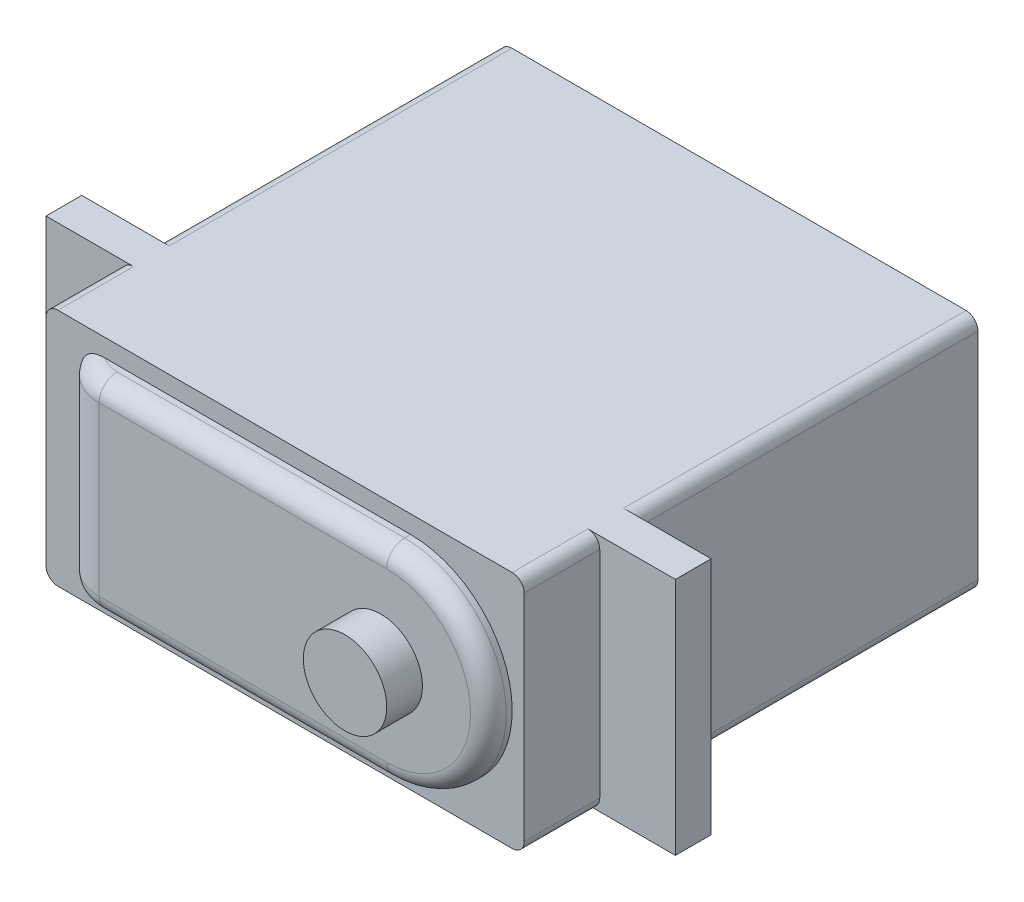
from build123d import *

# Parameters (mm, degrees)
SKETCH1_W           = 40.132
SKETCH1_H           = 20.066
BOSS_EXTRUDE1_DEPTH = 38.1
SKETCH2_W           = 6.35
SKETCH2_H           = 20.066
BOSS_EXTRUDE2_DEPTH = 3
BOSS_EXTRUDE4_DEPTH = 2
SKETCH5_R           = 3.5
BOSS_EXTRUDE3_DEPTH = 3
FILLET2_R           = 4
FILLET3_R           = 1.5
FILLET4_R           = 1


with BuildPart() as part:
    # Sketch1 → Boss-Extrude1 (new body)
    with BuildSketch(Plane.XY):
        Rectangle(SKETCH1_W, SKETCH1_H)
    extrude(amount=BOSS_EXTRUDE1_DEPTH)

    # Sketch2 → Boss-Extrude2 (add)
    with BuildSketch(Plane(origin=(0, 0, 31.75), x_dir=(-1, 0, 0), z_dir=(0, 0, -1))):
        with Locations((23.241, 0)):
            Rectangle(SKETCH2_W, SKETCH2_H)
        with Locations((-23.241, 0)):
            Rectangle(SKETCH2_W, SKETCH2_H)
    extrude(amount=BOSS_EXTRUDE2_DEPTH)

    # Sketch6 → Boss-Extrude4 (add)
    with BuildSketch(Plane.XY.offset(38.1)):
        with BuildLine():
            Line((-17.066, 8.533), (10.533, 8.533))
            ThreePointArc((10.533, 8.533), (19.066, 0), (10.533, -8.533))
            Line((10.533, -8.533), (-17.066, -8.533))
            Line((-17.066, -8.533), (-17.066, 8.533))
        make_face()
    extrude(amount=BOSS_EXTRUDE4_DEPTH)

    # Sketch5 → Boss-Extrude3 (add)
    with BuildSketch(Plane.XY.offset(40.1)):
        with Locations((10.033, 0)):
            Circle(SKETCH5_R)
    extrude(amount=BOSS_EXTRUDE3_DEPTH)

    # Fillet2
    # the kernel refuses this fillet: 4 mm, written as the material it takes off along each edge
    with BuildSketch(Plane(origin=(-17.066, -17.193254038, 40.1), x_dir=(0, 0, -1), z_dir=(0, 1, 0))) as fillet2_piece_1:
        with BuildLine():
            CenterArc((4, -3.464101615), FILLET2_R, 120, 60)
            Line((0, -3.464101615), (-0.08, -3.464101615))
            Line((-0.08, -3.464101615), (-0.08, 0))
            Line((-0.08, 0), (0, 0.08))
            ThreePointArc((0, 0.08), (1, 0.08), (1.96, 0.069282032))
            Line((1.96, 0.069282032), (2, 0))
        make_face()
    extrude(amount=34.386508076, mode=Mode.SUBTRACT)

    # Fillet3
    fillet3_edges = [part.edges().sort_by_distance(p)[0] for p in [
        (19.066, 0, 40.1),
        (-1.534449192, 8.533, 40.1),
        (-1.534449192, -8.533, 40.1),
        (-15.601898385, -8.533, 39.564101615),
        (-15.601898385, 8.533, 39.564101615),
    ]]
    fillet(fillet3_edges, radius=FILLET3_R)

    # Fillet4
    fillet4_edges = [part.edges().sort_by_distance(p)[0] for p in [
        (-20.066, -10.033, 14.375),
        (-20.066, 10.033, 14.375),
        (20.066, 10.033, 14.375),
        (20.066, -10.033, 14.375),
        (20.066, -10.033, 34.925),
        (-20.066, -10.033, 34.925),
        (-20.066, 10.033, 34.925),
        (20.066, 10.033, 34.925),
    ]]
    fillet(fillet4_edges, radius=FILLET4_R)


solid = part.part
